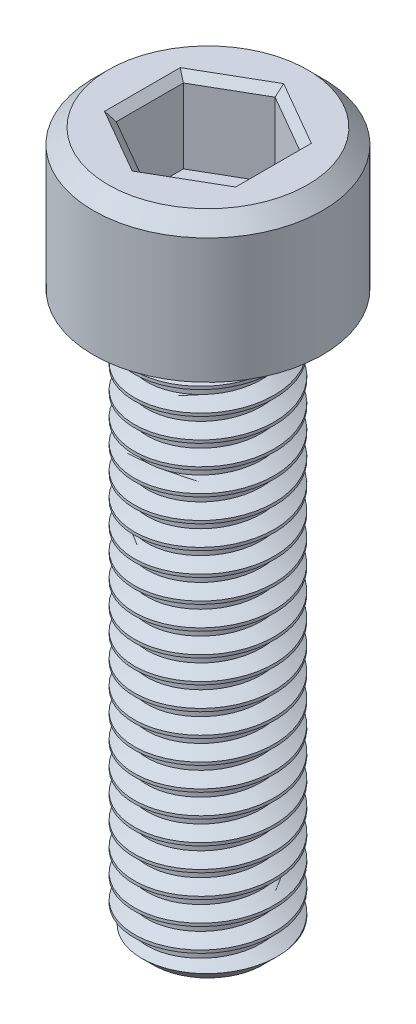
from build123d import *
from build123d.topology import SkipClean

# Parameters (mm, degrees)
SKETCH1_W           = 3.9116
SKETCH1_H           = 4.7752
SKETCH2_R           = 2.3876
BOSS_EXTRUDE1_DEPTH = 19.05
CUT_EXTRUDE1_DEPTH  = 2.794
CHAMFER1_SIZE       = 0.508
CHAMFER2_SIZE       = 0.254
THREAD1_PITCH       = 0.79375


with BuildPart() as part:
    # Sketch1 → Revolve1 (revolve)
    with BuildSketch(Plane(origin=(0, 0, 0), x_dir=(-1, 0, 0), z_dir=(0, 0, -1)), mode=Mode.PRIVATE) as revolve1_sk:
        with Locations((-1.9558, -2.3876)):
            Rectangle(SKETCH1_W, SKETCH1_H)
    revolve(revolve1_sk.sketch.rotate(Axis((0, -4.7752, 0), (0, 1, 0)), 270), axis=Axis((0, -4.7752, 0), (0, 1, 0)))

    # Sketch2 → Boss-Extrude1 (add)
    with BuildSketch(Plane.XZ.offset(4.7752)):
        with Locations(Location((0, 0, 0), (0, 0, 90))):
            Circle(SKETCH2_R)
    extrude(amount=BOSS_EXTRUDE1_DEPTH)

    # Sketch3 → Cut-Extrude1 (cut)
    with BuildSketch(Plane(origin=(0, 0, 0), x_dir=(-1, 0, 0), z_dir=(0, 1, 0))):
        Polygon((1.984375, -1.14567944), (1.984375, 1.14567944), (0, 2.291358881), (-1.984375, 1.14567944), (-1.984375, -1.14567944), (0, -2.291358881), align=None)
    extrude(amount=-CUT_EXTRUDE1_DEPTH, mode=Mode.SUBTRACT)

    # Chamfer1
    chamfer1_edges = [part.edges().sort_by_distance(p)[0] for p in [
        (0, 0, -3.9116),
        (0, -23.8252, -2.3876),
    ]]
    chamfer(chamfer1_edges, length=CHAMFER1_SIZE)

    # Chamfer2
    chamfer2_edges = [part.edges().sort_by_distance(p)[0] for p in [
        (-0.9921875, 0, -1.718519161),
        (-1.984375, 0, 0),
        (-0.9921875, 0, 1.718519161),
        (0.9921875, 0, 1.718519161),
        (1.984375, 0, 0),
        (0.9921875, 0, -1.718519161),
    ]]
    chamfer(chamfer2_edges, length=CHAMFER2_SIZE)

    # Thread1: the profile of Thread Profile1 profile screwed along a right-hand helix of 23.36 turns, 8 arcs to a turn; built about Z, then put on its axis
    with SkipClean():  # the faces are left unmerged after this step: merging them gives an invalid solid
        thread1_z = Axis((0, 0, 0), (0, 0, 1))
        thread1_corners = [(2.3879, 0, -0.000173205), (2.3879, 0, 0.694704453), (1.957970212, 0, 0.446484374), (1.957970212, 0, 0.248046874)]
        with BuildLine(mode=Mode.PRIVATE) as thread1_profile:
            Line(thread1_corners[0], thread1_corners[1])
            Line(thread1_corners[1], thread1_corners[2])
            Line(thread1_corners[2], thread1_corners[3])
            Line(thread1_corners[3], thread1_corners[0])
        thread1_cap = Face(thread1_profile.wire())
        thread1_turn_angles = [0, 22.5, 45, 67.5, 90, 112.5, 135, 157.5, 180, 202.5, 225, 247.5, 270, 292.5, 315, 337.5, 360]
        thread1_turn_weights = [1, 0.9238795325112867, 1, 0.9238795325112867, 1, 0.9238795325112867, 1, 0.9238795325112867, 1, 0.9238795325112867, 1, 0.9238795325112867, 1, 0.9238795325112867, 1, 0.9238795325112867, 1]
        thread1_turn_rails = [Edge.make_bspline([Vector(p[0], p[1], 0).rotate(thread1_z, thread1_turn_angles[k]) / thread1_turn_weights[k] + Vector(0, 0, p[2] + THREAD1_PITCH * thread1_turn_angles[k] / 360) for k in range(17)], [0, 0, 0, 1, 1, 2, 2, 3, 3, 4, 4, 5, 5, 6, 6, 7, 7, 8, 8, 8], 2, thread1_turn_weights) for p in thread1_corners]
        thread1_turn_sides = [Face.make_surface_from_curves(thread1_turn_rails[p[0]], thread1_turn_rails[p[1]]) for p in [(0, 1), (1, 2), (2, 3), (3, 0)]]
        thread1_last_angles = [8280, 8302.5, 8325, 8347.5, 8370, 8389.8, 8409.6]
        thread1_last_weights = [1, 0.9238795325112867, 1, 0.9238795325112867, 1, 0.9408807689541814, 1]
        thread1_last_rails = [Edge.make_bspline([Vector(p[0], p[1], 0).rotate(thread1_z, thread1_last_angles[k]) / thread1_last_weights[k] + Vector(0, 0, p[2] + THREAD1_PITCH * thread1_last_angles[k] / 360) for k in range(7)], [0, 0, 0, 1, 1, 2, 2, 3, 3, 3], 2, thread1_last_weights) for p in thread1_corners]
        thread1_last_sides = [Face.make_surface_from_curves(thread1_last_rails[p[0]], thread1_last_rails[p[1]]) for p in [(0, 1), (1, 2), (2, 3), (3, 0)]]
        thread1 = Plane(origin=(0, -4.7752, 0), x_dir=(-1, 0, 0), z_dir=(0, -1, 0)) * Solid(Shell([*[p.moved(Location((0, 0, THREAD1_PITCH * i))) for i in range(23) for p in thread1_turn_sides], *thread1_last_sides, thread1_cap, thread1_cap.rotate(thread1_z, 8409.6).moved(Location((0, 0, THREAD1_PITCH * 8409.6 / 360)))]))
        add(thread1, mode=Mode.SUBTRACT)


solid = part.part
